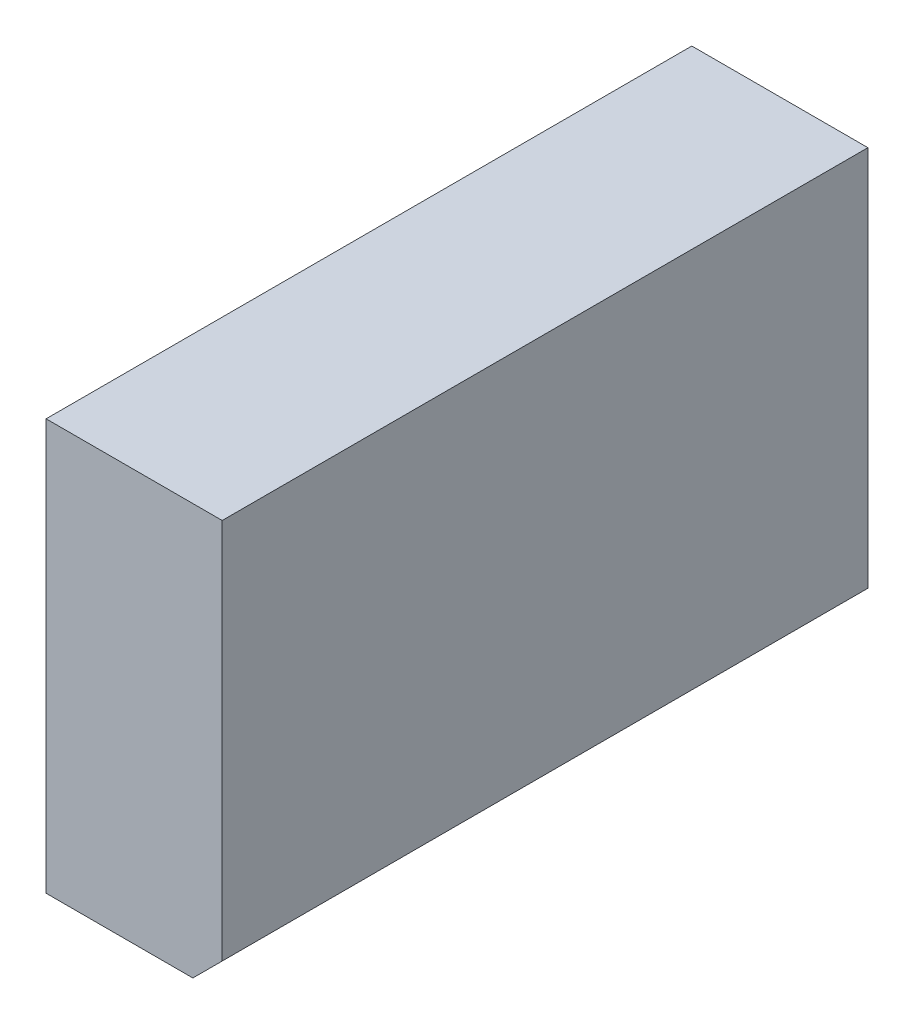
from build123d import *

# Parameters (mm, degrees)
SKETCH1_W           = 38.1
SKETCH1_H           = 88.9
BOSS_EXTRUDE1_DEPTH = 139.7
CHAMFER1_SIZE       = 6.35


with BuildPart() as part:
    # Sketch1 → Boss-Extrude1 (new body)
    with BuildSketch(Plane.XY):
        with Locations((19.05, 44.45)):
            Rectangle(SKETCH1_W, SKETCH1_H)
    extrude(amount=BOSS_EXTRUDE1_DEPTH)

    # Chamfer1
    chamfer1_edges = [part.edges().sort_by_distance(p)[0] for p in [
        (38.1, 0, 69.85),
    ]]
    chamfer(chamfer1_edges, length=CHAMFER1_SIZE)


solid = part.part
